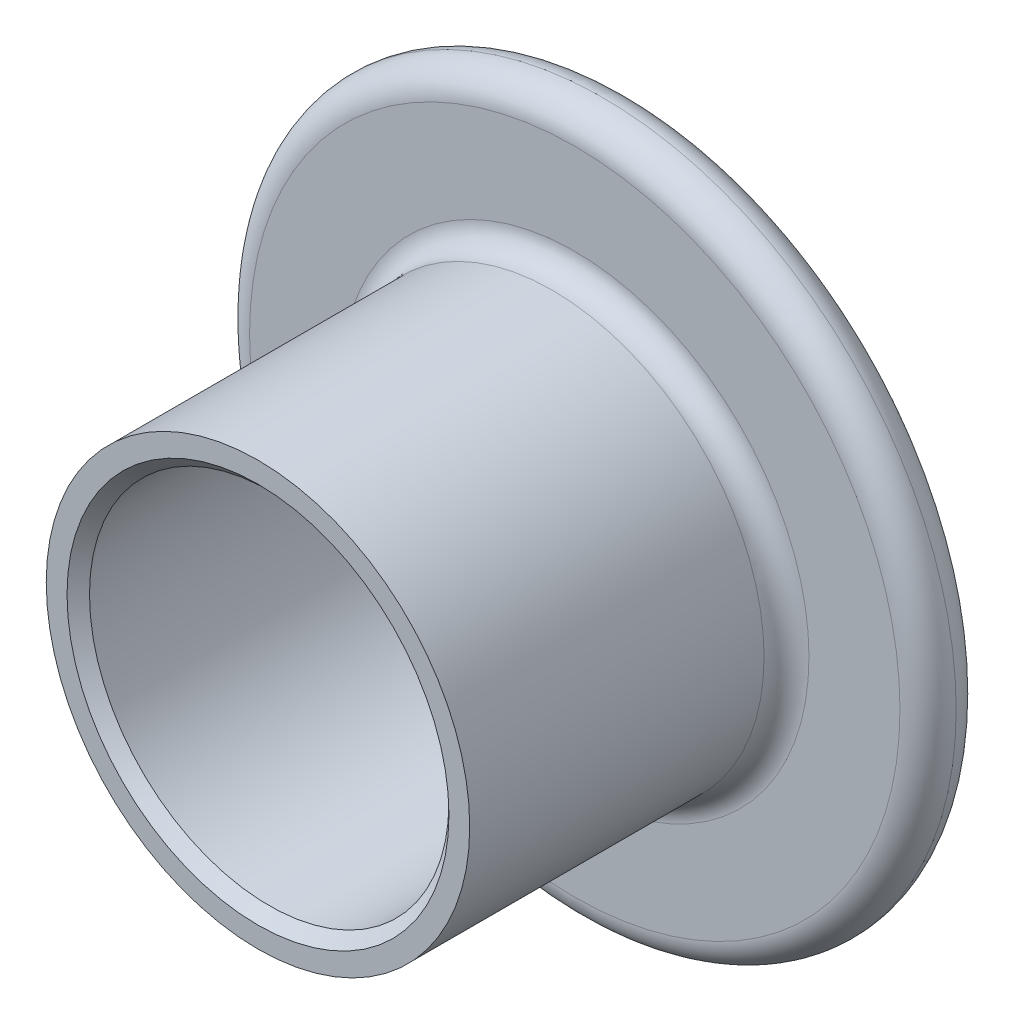
from build123d import *

# Parameters (mm, degrees)
BOSS_EXTRUDE1_START     = -2.5
BOSS_EXTRUDE1_OUTLINE_R = 31.45
BOSS_EXTRUDE1_DEPTH     = 5
SKETCH2_R               = 18.85
BOSS_EXTRUDE2_DEPTH     = 28.2
SKETCH3_R               = 19.15
BOSS_EXTRUDE3_DEPTH     = 5
SKETCH5_R               = 16
CUT_EXTRUDE2_DEPTH      = 59.629727954
FILLET7_R               = 2
CHAMFER2_SIZE           = 1
FILLET8_R               = 2.5
FILLET9_R               = 1.5


# Read off the part's stored shape, not the designer's step: Boss-Extrude1
with BuildPart() as part:
    # Boss-Extrude1 outline → Boss-Extrude1 (new body)
    with BuildSketch(Plane.XY.offset(BOSS_EXTRUDE1_START)):
        Circle(BOSS_EXTRUDE1_OUTLINE_R)
    extrude(amount=BOSS_EXTRUDE1_DEPTH)

    # Sketch2 → Boss-Extrude2 (add)
    with BuildSketch(Plane.XY.offset(2.5)):
        Circle(SKETCH2_R)
    extrude(amount=BOSS_EXTRUDE2_DEPTH)

    # Sketch3 → Boss-Extrude3 (add)
    with BuildSketch(Plane(origin=(0, 0, -2.5), x_dir=(-1, 0, 0), z_dir=(0, 0, -1))):
        with Locations(Location((0, 0, 0), (0, 0, 180))):
            Circle(SKETCH3_R)
    extrude(amount=BOSS_EXTRUDE3_DEPTH)

    # Sketch5 → Cut-Extrude2 (cut, through all)
    with BuildSketch(Plane.XY.offset(30.7)):
        Circle(SKETCH5_R)
    extrude(amount=-CUT_EXTRUDE2_DEPTH, mode=Mode.SUBTRACT)

    # Fillet7
    fillet7_edges = [part.edges().sort_by_distance(p)[0] for p in [
        (-18.85, 0, 2.5),
    ]]
    fillet(fillet7_edges, radius=FILLET7_R)

    # Chamfer2
    chamfer2_edges = [part.edges().sort_by_distance(p)[0] for p in [
        (-16, 0, 30.7),
    ]]
    chamfer(chamfer2_edges, length=CHAMFER2_SIZE)

    # Fillet8
    fillet8_edges = [part.edges().sort_by_distance(p)[0] for p in [
        (-31.45, 0, -2.5),
        (-31.45, 0, 2.5),
    ]]
    fillet(fillet8_edges, radius=FILLET8_R - 0.0001)  # a hair under: the kernel refuses the full size

    # Fillet9
    fillet9_edges = [part.edges().sort_by_distance(p)[0] for p in [
        (-19.15, 0, -7.5),
    ]]
    fillet(fillet9_edges, radius=FILLET9_R)


solid = part.part
